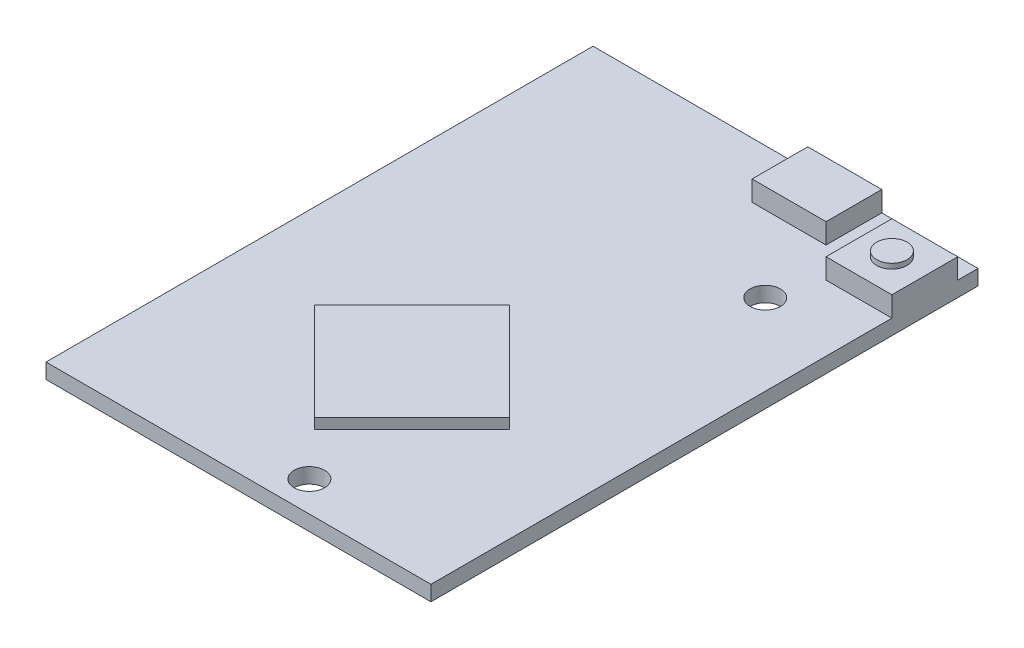
from build123d import *

# Parameters (mm, degrees)
SKETCH1_W               = 38
SKETCH1_H               = 54
PCB_DEPTH               = 1.5
ATMEGA_DEPTH            = 1
SKETCH3_W               = 7.3
SKETCH3_H               = 5.5
SKETCH3_W_2             = 6.5
SKETCH3_H_2             = 6.5
USB_AND_RST_DEPTH       = 2
SKETCH4_R               = 1.5
BUTTON_DEPTH            = 0.5
CUT_EXTRUDE1_DEPTH      = 34.109666262
CUT_EXTRUDE1_DEPTH_BACK = 34.109666262
SKETCH5_R               = 1.5


with BuildPart() as part:
    # Sketch1 → PCB (new body)
    with BuildSketch(Plane(origin=(0, 0, 0), x_dir=(1, 0, 0), z_dir=(0, 1, 0))):
        Rectangle(SKETCH1_W, SKETCH1_H)
    extrude(amount=PCB_DEPTH)

    # Sketch2 → ATMega (add)
    with BuildSketch(Plane(origin=(0, 1.5, 0), x_dir=(1, 0, 0), z_dir=(0, 1, 0))):
        Polygon((0, -0.266695552), (9.616652224, -9.883347776), (0, -19.5), (-9.616652224, -9.883347776), align=None)
    extrude(amount=ATMEGA_DEPTH)

    # Sketch3 → USB and RST (add)
    with BuildSketch(Plane(origin=(0, 1.5, 0), x_dir=(1, 0, 0), z_dir=(0, 1, 0))):
        with Locations((5.85, 24.25)):
            Rectangle(SKETCH3_W, SKETCH3_H)
        with Locations((15.75, 21.75)):
            Rectangle(SKETCH3_W_2, SKETCH3_H_2)
    extrude(amount=USB_AND_RST_DEPTH)

    # Sketch4 → Button (add)
    with BuildSketch(Plane(origin=(0, 3.5, 0), x_dir=(1, 0, 0), z_dir=(0, 1, 0))):
        with Locations((15.75, 21.75)):
            Circle(SKETCH4_R)
    extrude(amount=BUTTON_DEPTH)

    # Sketch5 → Cut-Extrude1 (cut, two sides: drawn at the far end of the back side and taken through both)
    with BuildSketch(Plane(origin=(0, 1.5, 0), x_dir=(1, 0, 0), z_dir=(0, 1, 0)).offset(-CUT_EXTRUDE1_DEPTH_BACK)):
        with Locations((11, 14)):
            Circle(SKETCH5_R)
        with Locations((4, -24)):
            Circle(SKETCH5_R)
    extrude(amount=CUT_EXTRUDE1_DEPTH + CUT_EXTRUDE1_DEPTH_BACK, mode=Mode.SUBTRACT)


solid = part.part
